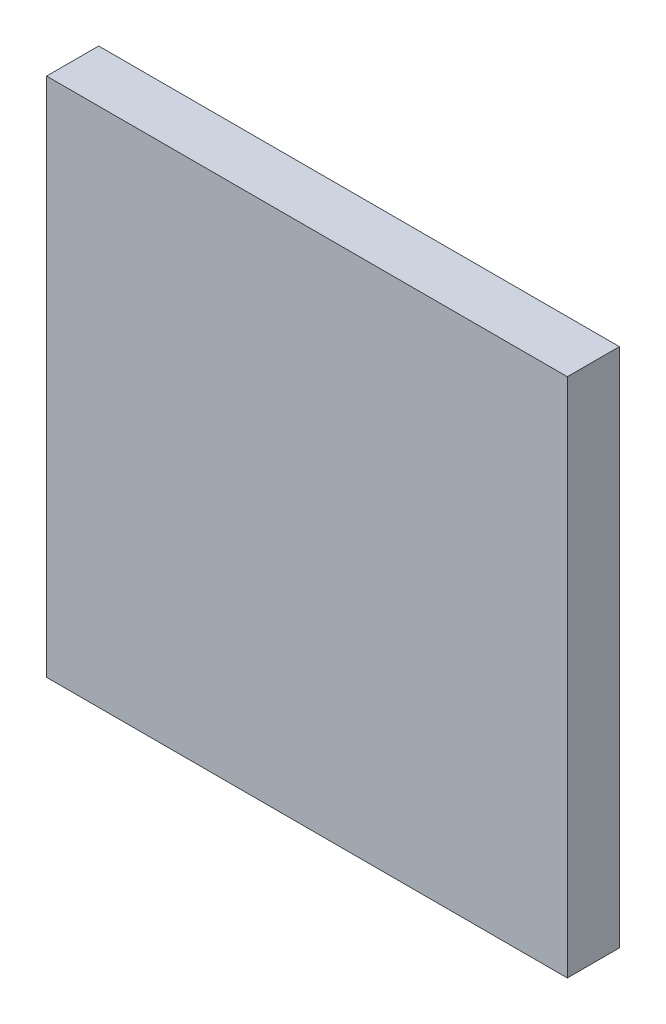
from build123d import *

# Parameters (mm, degrees)
SKETCH_1_W      = 20000
SKETCH_1_H      = 20000
EXTRUDE_1_DEPTH = 2000


with BuildPart() as part:
    # 草图1 → 凸台-拉伸1 (new body)
    with BuildSketch(Plane.XY):
        with Locations((10000, 10000)):
            Rectangle(SKETCH_1_W, SKETCH_1_H)
    extrude(amount=EXTRUDE_1_DEPTH)


solid = part.part
